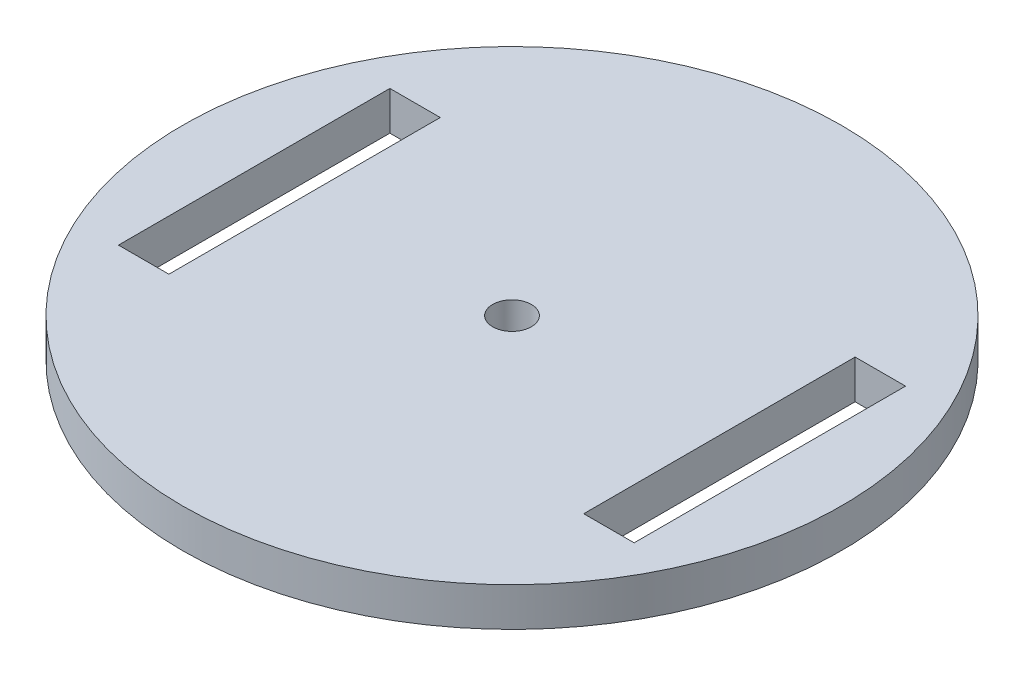
from build123d import *

# Parameters (mm, degrees)
SKETCH1_R           = 85
SKETCH1_W           = 13
SKETCH1_H           = 70
BOSS_EXTRUDE1_DEPTH = 10
CUT_EXTRUDE1_REACH  = 122.623
SKETCH2_R           = 5


with BuildPart() as part:
    # Sketch1 → Boss-Extrude1 (new body)
    with BuildSketch(Plane(origin=(0, 0, 0), x_dir=(1, 0, 0), z_dir=(0, 1, 0))):
        Circle(SKETCH1_R)
        with Locations((-60, 0)):
            Rectangle(SKETCH1_W, SKETCH1_H, mode=Mode.SUBTRACT)
        with Locations((60, 0)):
            Rectangle(SKETCH1_W, SKETCH1_H, mode=Mode.SUBTRACT)
    extrude(amount=BOSS_EXTRUDE1_DEPTH)

    # Sketch2 → Cut-Extrude1 (cut, up to next)
    with BuildSketch(Plane.XZ, mode=Mode.PRIVATE) as cut_extrude1_sk1:
        Circle(SKETCH2_R)
    cut_extrude1_tool1 = extrude(cut_extrude1_sk1.sketch, amount=-CUT_EXTRUDE1_REACH, mode=Mode.PRIVATE) & part.part
    add(cut_extrude1_tool1.solids().sort_by_distance((0, 0, 0))[0], mode=Mode.SUBTRACT)


solid = part.part
